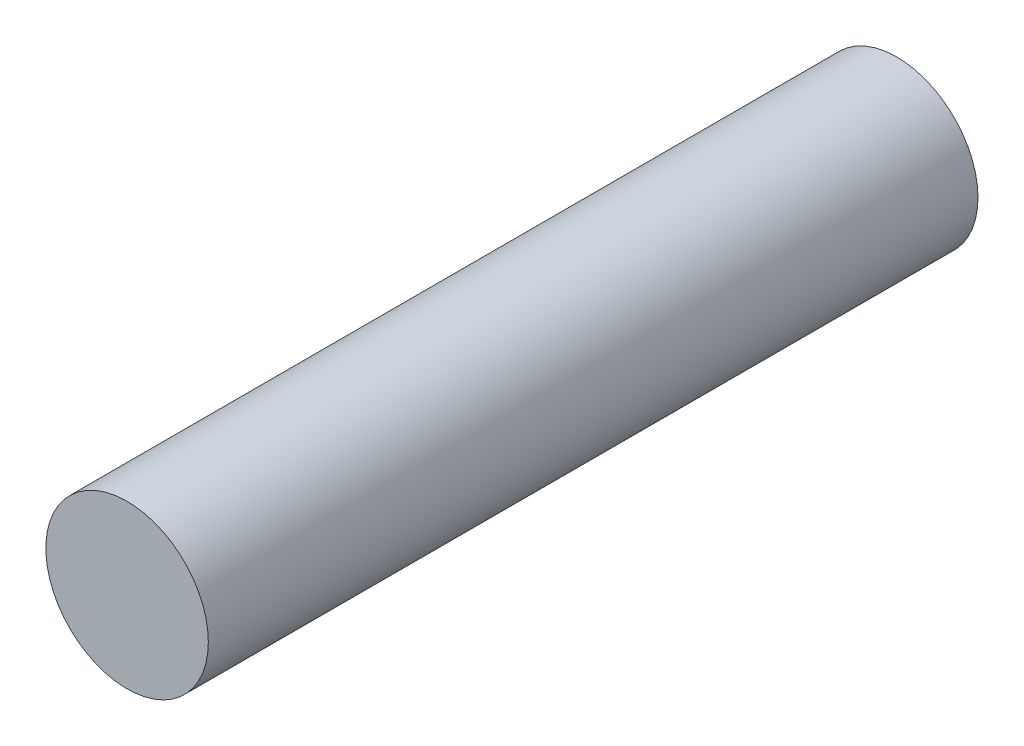
from build123d import *

# Parameters (mm, degrees)
SKETCH1_R           = 24.13
BOSS_EXTRUDE1_DEPTH = 228.6


with BuildPart() as part:
    # Sketch1 → Boss-Extrude1 (new body)
    with BuildSketch(Plane.XY):
        Circle(SKETCH1_R)
    extrude(amount=BOSS_EXTRUDE1_DEPTH)


solid = part.part
